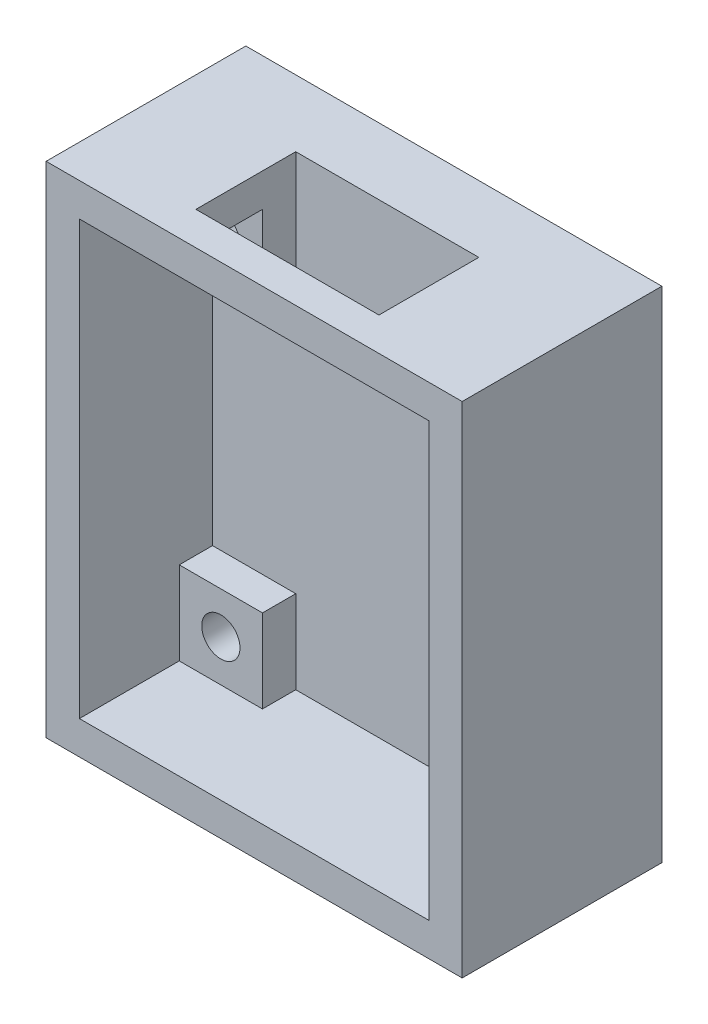
from build123d import *

# Parameters (mm, degrees)
SKETCH_1_W          = 25
SKETCH_1_H          = 30
EXTRUDE_1_DEPTH     = 12
SKETCH_2_W          = 21
SKETCH_2_H          = 26
CUT_EXTRUDE_1_DEPTH = 8
SKETCH_4_W          = 5
SKETCH_4_H          = 5
EXTRUDE_2_DEPTH     = 2
SKETCH_5_W          = 11
SKETCH_5_H          = 6
CUT_EXTRUDE_3_DEPTH = 90.262162447
SKETCH_6_R          = 1.15
CUT_EXTRUDE_4_DEPTH = 94.437036651


with BuildPart() as part:
    # ｽｹｯﾁ1 → ﾎﾞｽ - 押し出し1 (new body)
    with BuildSketch(Plane.XY):
        with Locations((-71.40312059, 25.678571429)):
            Rectangle(SKETCH_1_W, SKETCH_1_H)
    extrude(amount=EXTRUDE_1_DEPTH)

    # ｽｹｯﾁ2 → ｶｯﾄ - 押し出し1 (cut)
    with BuildSketch(Plane.XY.offset(12)):
        with Locations((-71.40312059, 25.678571429)):
            Rectangle(SKETCH_2_W, SKETCH_2_H)
    extrude(amount=-CUT_EXTRUDE_1_DEPTH, mode=Mode.SUBTRACT)

    # ｽｹｯﾁ4 → ﾎﾞｽ - 押し出し2 (add)
    with BuildSketch(Plane.XY.offset(4)):
        with Locations((-63.40312059, 36.178571429)):
            Rectangle(SKETCH_4_W, SKETCH_4_H)
        with Locations((-63.40312059, 15.178571429)):
            Rectangle(SKETCH_4_W, SKETCH_4_H)
        with Locations((-79.40312059, 15.178571429)):
            Rectangle(SKETCH_4_W, SKETCH_4_H)
        with Locations((-79.40312059, 36.178571429)):
            Rectangle(SKETCH_4_W, SKETCH_4_H)
    extrude(amount=EXTRUDE_2_DEPTH)

    # ｽｹｯﾁ5 → ｶｯﾄ - 押し出し3 (cut, through all)
    with BuildSketch(Plane(origin=(0, 38.678571429, 0), x_dir=(-1, 0, 0), z_dir=(0, -1, 0))):
        with Locations((71.40312059, -7)):
            Rectangle(SKETCH_5_W, SKETCH_5_H)
    extrude(amount=-CUT_EXTRUDE_3_DEPTH, mode=Mode.SUBTRACT)

    # ｽｹｯﾁ6 → ｶｯﾄ - 押し出し4 (cut, through all)
    with BuildSketch(Plane.XY.offset(6)):
        with Locations((-63.40312059, 36.178571429)):
            Circle(SKETCH_6_R)
        with Locations((-63.40312059, 15.178571429)):
            Circle(SKETCH_6_R)
        with Locations((-79.40312059, 36.178571429)):
            Circle(SKETCH_6_R)
        with Locations((-79.40312059, 15.178571429)):
            Circle(SKETCH_6_R)
    extrude(amount=-CUT_EXTRUDE_4_DEPTH, mode=Mode.SUBTRACT)


solid = part.part
